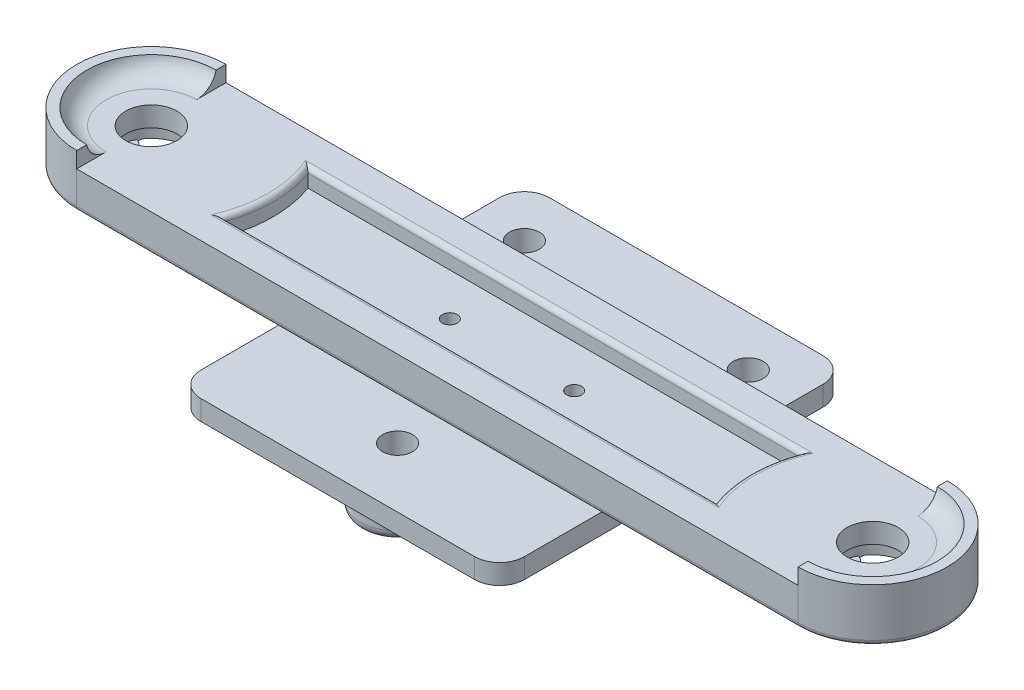
from build123d import *

# Parameters (mm, degrees)
CROQUIS1_R               = 15
CROQUIS1_R_2             = 5.15
SALIENTE_EXTRUIR1_DEPTH  = 7.5
CROQUIS2_R               = 5.15
CORTAR_EXTRUIR1_DEPTH    = 3.5
SALIENTE_EXTRUIR6_DEPTH  = 3.2
CROQUIS13_R              = 1.5
CORTAR_EXTRUIR2_DEPTH    = 3.6
REDONDEO1_R              = 4
REDONDEO2_R              = 1
REDONDEO3_R              = 1
SALIENTE_EXTRUIR7_START  = 2
SALIENTE_EXTRUIR7_DEPTH  = 2
REDONDEO5_R              = 1
SALIENTE_EXTRUIR8_DEPTH  = 4
CROQUIS13_2_R            = 1.5
CORTAR_EXTRUIR3_DEPTH    = 95.939454391
CROQUIS16_R              = 7.5
CROQUIS16_R_2            = 3
SALIENTE_EXTRUIR9_DEPTH  = 8
CROQUIS16_3_R            = 7.5
CROQUIS16_3_R_2          = 3
SALIENTE_EXTRUIR10_DEPTH = 8
CROQUIS16_4_R            = 3
CORTAR_EXTRUIR4_DEPTH    = 96.379976934
REDONDEO6_R              = 2
CROQUIS19_R              = 3
CORTAR_EXTRUIR5_DEPTH    = 96.379976934


with BuildPart() as part:
    # Croquis1 → Saliente-Extruir1 (new body)
    # profile 1 of 3: a face of its own
    with BuildSketch(Plane(origin=(0, 0, 0), x_dir=(1, 0, 0), z_dir=(0, 1, 0))):
        with Locations((-72.5, 0)):
            Circle(CROQUIS1_R)
        with Locations(Location((-72.5, 0, 0), (0, 0, 270))):
            Circle(CROQUIS1_R_2, mode=Mode.SUBTRACT)
    # profile 2 of 3: a face of its own
    with BuildSketch(Plane(origin=(0, 0, 0), x_dir=(1, 0, 0), z_dir=(0, 1, 0))):
        with BuildLine():
            Line((72.5, 15), (-72.5, 15))
            ThreePointArc((-72.5, 15), (-61.893398282, 10.606601718), (-57.5, 0))
            ThreePointArc((-57.5, 0), (-61.893398282, -10.606601718), (-72.5, -15))
            Line((-72.5, -15), (72.5, -15))
            ThreePointArc((72.5, -15), (57.5, 0), (72.5, 15))
        make_face()
    # profile 3 of 3: a face of its own
    with BuildSketch(Plane(origin=(0, 0, 0), x_dir=(1, 0, 0), z_dir=(0, 1, 0))):
        with Locations((72.5, 0)):
            Circle(CROQUIS1_R)
        with Locations(Location((72.5, 0, 0), (0, 0, 270))):
            Circle(CROQUIS1_R_2, mode=Mode.SUBTRACT)
    extrude(amount=SALIENTE_EXTRUIR1_DEPTH)

    # Croquis2 → Cortar-Extruir1 (cut)
    with BuildSketch(Plane.XZ):
        with BuildLine():
            ThreePointArc((-72.5, -5.15), (-77.65, 0), (-72.5, 5.15))
            Line((-72.5, 5.15), (-72.5, 7.5))
            ThreePointArc((-72.5, 7.5), (-80, 0), (-72.5, -7.5))
            Line((-72.5, -7.5), (-72.5, -5.15))
        make_face()
        with BuildLine():
            Line((-72.5, 7.5), (-72.5, 5.15))
            ThreePointArc((-72.5, 5.15), (-68.858400077, 3.641599923), (-67.35, 0))
            ThreePointArc((-67.35, 0), (-68.858400077, -3.641599923), (-72.5, -5.15))
            Line((-72.5, -5.15), (-72.5, -7.5))
            ThreePointArc((-72.5, -7.5), (-65, 0), (-72.5, 7.5))
        make_face()
        with BuildLine():
            Line((72.5, -7.5), (72.5, -5.15))
            ThreePointArc((72.5, -5.15), (67.35, 0), (72.5, 5.15))
            Line((72.5, 5.15), (72.5, 7.5))
            ThreePointArc((72.5, 7.5), (65, 0), (72.5, -7.5))
        make_face()
        with BuildLine():
            ThreePointArc((77.65, 0), (76.141599923, -3.641599923), (72.5, -5.15))
            Line((72.5, -5.15), (72.5, -7.5))
            ThreePointArc((72.5, -7.5), (80, 0), (72.5, 7.5))
            Line((72.5, 7.5), (72.5, 5.15))
            ThreePointArc((72.5, 5.15), (76.141599923, 3.641599923), (77.65, 0))
        make_face()
        with Locations(Location((72.5, 0, 0), (0, 0, 270))):
            Circle(CROQUIS2_R)
    extrude(amount=-CORTAR_EXTRUIR1_DEPTH, mode=Mode.SUBTRACT)

    # Croquis9 → Saliente-Extruir6 (add)
    with BuildSketch(Plane(origin=(0, 7.5, 0), x_dir=(1, 0, 0), z_dir=(0, 1, 0))):
        with BuildLine():
            Line((-72.5, 15), (-72.5, 13))
            ThreePointArc((-72.5, 13), (-85.5, 0), (-72.5, -13))
            Line((-72.5, -13), (-72.5, -15))
            ThreePointArc((-72.5, -15), (-87.5, 0), (-72.5, 15))
        make_face()
        with BuildLine():
            Line((72.5, 15), (72.5, 13))
            ThreePointArc((72.5, 13), (85.5, 0), (72.5, -13))
            Line((72.5, -13), (72.5, -15))
            ThreePointArc((72.5, -15), (87.5, 0), (72.5, 15))
        make_face()
    extrude(amount=SALIENTE_EXTRUIR6_DEPTH)

    # Croquis13 → Cortar-Extruir2 (cut)
    with BuildSketch(Plane(origin=(0, 7.5, 0), x_dir=(1, 0, 0), z_dir=(0, 1, 0))):
        with BuildLine():
            Line((49.521749414, -8.5), (-49.521749414, -8.5))
            ThreePointArc((-49.521749414, -8.5), (-48, 0), (-49.521749414, 8.5))
            Line((-49.521749414, 8.5), (49.521749414, 8.5))
            ThreePointArc((49.521749414, 8.5), (48, 0), (49.521749414, -8.5))
        make_face()
        with Locations(Location((-12.5, 0, 0), (0, 0, 270))):
            Circle(CROQUIS13_R, mode=Mode.SUBTRACT)
        with Locations(Location((12.5, 0, 0), (0, 0, 90))):
            Circle(CROQUIS13_R, mode=Mode.SUBTRACT)
    extrude(amount=-CORTAR_EXTRUIR2_DEPTH, mode=Mode.SUBTRACT)

    # Redondeo1
    # the kernel refuses this fillet: 4 mm, written as the material it adds along each edge
    with BuildSketch(Plane(origin=(72.5, 7.5, 0), x_dir=(0, 0, -1), z_dir=(-1, 0, 0))) as redondeo1_piece_1:
        with BuildLine():
            CenterArc((9.080816412, -4), REDONDEO1_R, 11.536959033, 78.463040967)
            Line((13, -3.2), (13.078383672, -3.184))
            ThreePointArc((13.078383672, -3.184), (13.08, -1.6), (13.08, 0))
            Line((13.08, 0), (13, 0.08))
            Line((13, 0.08), (9.080816412, 0.08))
            Line((9.080816412, 0.08), (9.080816412, 0))
        make_face()
    revolve(axis=Axis((72.5, 7.5, 0), (0, -1, 0)), revolution_arc=180)
    with BuildSketch(Plane(origin=(-72.5, 7.5, 0), x_dir=(0, 0, -1), z_dir=(1, 0, 0))) as redondeo1_piece_2:
        with BuildLine():
            CenterArc((9.080816412, 4), REDONDEO1_R, 270, 78.463040967)
            Line((13, 3.2), (13.078383672, 3.184))
            ThreePointArc((13.078383672, 3.184), (13.08, 1.6), (13.08, 0))
            Line((13.08, 0), (13, -0.08))
            Line((13, -0.08), (9.080816412, -0.08))
            Line((9.080816412, -0.08), (9.080816412, 0))
        make_face()
    revolve(axis=Axis((-72.5, 7.5, 0), (0, 1, 0)), revolution_arc=180)

    # Redondeo2
    redondeo2_edges = [part.edges().sort_by_distance(p)[0] for p in [
        (-87.5, 0, 0),
        (0, 0, -15),
        (87.5, 0, 0),
        (0, 0, 15),
    ]]
    fillet(redondeo2_edges, radius=REDONDEO2_R)

    # Redondeo3
    redondeo3_edges = [part.edges().sort_by_distance(p)[0] for p in [
        (48, 7.5, 0),
        (0, 7.5, -8.5),
        (-48, 7.5, 0),
        (0, 7.5, 8.5),
    ]]
    fillet(redondeo3_edges, radius=REDONDEO3_R)

    # Croquis14 → Saliente-Extruir7 (add)
    with BuildSketch(Plane.XZ.offset(SALIENTE_EXTRUIR7_START)):
        with BuildLine():
            Line((-78.934449598, 3.602473326), (-81.185988533, 4.205771366))
            ThreePointArc((-81.185988533, 4.205771366), (-82.2614458, 0), (-81.185988533, -4.205771366))
            Line((-81.185988533, -4.205771366), (-78.934449598, -3.602473326))
            ThreePointArc((-78.934449598, -3.602473326), (-77.733165492, -2.693023984), (-77.507447775, -1.203314912))
            ThreePointArc((-77.507447775, -1.203314912), (-77.65, 0), (-77.507447775, 1.203314912))
            ThreePointArc((-77.507447775, 1.203314912), (-77.733165492, 2.693023984), (-78.934449598, 3.602473326))
        make_face()
        with BuildLine():
            Line((-66.065550402, -3.602473326), (-63.814011467, -4.205771366))
            ThreePointArc((-63.814011467, -4.205771366), (-62.7385542, 0), (-63.814011467, 4.205771366))
            Line((-63.814011467, 4.205771366), (-66.065550402, 3.602473326))
            ThreePointArc((-66.065550402, 3.602473326), (-67.266834508, 2.693023984), (-67.492552225, 1.203314912))
            ThreePointArc((-67.492552225, 1.203314912), (-67.35, 0), (-67.492552225, -1.203314912))
            ThreePointArc((-67.492552225, -1.203314912), (-67.266834508, -2.693023984), (-66.065550402, -3.602473326))
        make_face()
    extrude(amount=-SALIENTE_EXTRUIR7_DEPTH)

    # Redondeo5
    # the kernel refuses this fillet: 1 mm, written as the material it takes off along each edge
    with BuildSketch(Plane(origin=(-81.185988533, -4.193298446, 4.205771366), x_dir=(-0.435508259696017, 0, -0.9001847342276733), z_dir=(0, 1, 0)), Plane(origin=(-63.814011467, -4.193298446, -4.205771366), x_dir=(0.435508259696011, 0, 0.9001847342276761), z_dir=(0, 1, 0))) as redondeo5_piece_1:
        with BuildLine():
            CenterArc((0.827252335, -0.998745859), REDONDEO5_R, 87.130169883, 82.052190477)
            Line((-0.15497718, -0.811062137), (0, 0))
            ThreePointArc((0, 0), (0.438659689, 0.010988087), (0.877319378, 0))
        make_face()
    extrude(amount=4.193298446, mode=Mode.SUBTRACT)
    with BuildSketch(Plane(origin=(-81.185988533, -4.193298446, -4.205771366), x_dir=(0.9659258262890669, 0, 0.2588190451025264), z_dir=(0, 1, 0)), Plane(origin=(-63.814011467, -4.193298446, 4.205771366), x_dir=(-0.9659258262890679, 0, -0.2588190451025224), z_dir=(0, 1, 0))) as redondeo5_piece_2:
        with BuildLine():
            CenterArc((0.825735864, -1), REDONDEO5_R, 90, 82.052190477)
            ThreePointArc((-0.164658567, -0.861728988), (-0.093122107, -0.428802209), (0, 0))
            Line((0, 0), (0.825735864, 0))
        make_face()
    extrude(amount=4.193298446, mode=Mode.SUBTRACT)
    with BuildSketch(Plane(origin=(-73.5, -2, 0), x_dir=(-0.7066256100563062, 0, 0.7075876251126452), z_dir=(0.7075876251126452, 0, 0.7066256100563062))) as redondeo5_piece_3:
        with BuildLine():
            CenterArc((8.7614458 - REDONDEO5_R, -REDONDEO5_R), REDONDEO5_R, 0, 90)
            Line((8.7614458 - REDONDEO5_R, 0), (8.7614458, 0))
            Line((8.7614458, 0), (8.7614458, -REDONDEO5_R))
        make_face()
    revolve(axis=Axis((-73.5, -2, 0), (0, -1, 0)), revolution_arc=90.077950613, mode=Mode.SUBTRACT)
    with BuildSketch(Plane(origin=(-71.5, -2, 0), x_dir=(0.706625610056301, 0, -0.70758762511265), z_dir=(-0.70758762511265, 0, -0.706625610056301))) as redondeo5_piece_4:
        with BuildLine():
            CenterArc((8.7614458 - REDONDEO5_R, -REDONDEO5_R), REDONDEO5_R, 0, 90)
            Line((8.7614458 - REDONDEO5_R, 0), (8.7614458, 0))
            Line((8.7614458, 0), (8.7614458, -REDONDEO5_R))
        make_face()
    revolve(axis=Axis((-71.5, -2, 0), (0, -1, 0)), revolution_arc=90.077950613, mode=Mode.SUBTRACT)
    # the kernel refuses this fillet: 1 mm, written as the material it adds along each edge
    with BuildSketch(Plane(origin=(-73.5, 0, 0), x_dir=(-0.920860386806379, 0, 0.38989248262925785), z_dir=(0.38989248262925785, 0, 0.920860386806379))) as redondeo5_2_piece_1:
        with BuildLine():
            CenterArc((8.7614458 + REDONDEO5_R, REDONDEO5_R), REDONDEO5_R, 180, 90)
            Line((8.7614458, REDONDEO5_R), (8.7614458, 0))
            Line((8.7614458, 0), (8.7614458 + REDONDEO5_R, 0))
        make_face()
    revolve(axis=Axis((-73.5, 0, 0), (0, -1, 0)), revolution_arc=45.895619046)
    with BuildSketch(Plane(origin=(-80.388388937, 0, -3.992055198), x_dir=(0.2588190451025228, 0, -0.9659258262890676), z_dir=(0.9659258262890678, 0, 0.25881904510252285))) as redondeo5_2_piece_2_section:
        with BuildLine():
            CenterArc((REDONDEO5_R, -REDONDEO5_R), REDONDEO5_R, 90, 90)
            Line((0, -REDONDEO5_R), (0, 0))
            Line((0, 0), (REDONDEO5_R, 0))
        make_face()
    redondeo5_2_piece_2 = extrude(amount=3.87558803, mode=Mode.PRIVATE)
    redondeo5_2_piece_2 = redondeo5_2_piece_2 - Plane(origin=(-72.5, 0, 0), x_dir=(0, 0, 1), z_dir=(0, -1, 0)) * Cylinder(7.5, 12, mode=Mode.PRIVATE)
    add(redondeo5_2_piece_2)
    with BuildSketch(Plane(origin=(-76.644858367, 0, 2.988979205), x_dir=(0.25881904510252285, 0, 0.9659258262890678), z_dir=(-0.9659258262890678, 0, 0.25881904510252285))) as redondeo5_2_piece_3_section:
        with BuildLine():
            CenterArc((REDONDEO5_R, -REDONDEO5_R), REDONDEO5_R, 90, 90)
            Line((0, -REDONDEO5_R), (0, 0))
            Line((0, 0), (REDONDEO5_R, 0))
        make_face()
    redondeo5_2_piece_3 = extrude(amount=3.87558803, mode=Mode.PRIVATE)
    redondeo5_2_piece_3 = redondeo5_2_piece_3 - Plane(origin=(-72.5, 0, 0), x_dir=(0, 0, 1), z_dir=(0, -1, 0)) * Cylinder(7.5, 12, mode=Mode.PRIVATE)
    add(redondeo5_2_piece_3)
    with BuildSketch(Plane(origin=(-68.355141633, 0, -2.988979205), x_dir=(-0.25881904510252285, 0, -0.9659258262890676), z_dir=(0.9659258262890678, 0, -0.25881904510252285))) as redondeo5_2_piece_4_section:
        with BuildLine():
            CenterArc((REDONDEO5_R, -REDONDEO5_R), REDONDEO5_R, 90, 90)
            Line((0, -REDONDEO5_R), (0, 0))
            Line((0, 0), (REDONDEO5_R, 0))
        make_face()
    redondeo5_2_piece_4 = extrude(amount=3.87558803, mode=Mode.PRIVATE)
    redondeo5_2_piece_4 = redondeo5_2_piece_4 - Plane(origin=(-72.5, 0, 0), x_dir=(0, 0, 1), z_dir=(0, -1, 0)) * Cylinder(7.5, 12, mode=Mode.PRIVATE)
    add(redondeo5_2_piece_4)
    with BuildSketch(Plane(origin=(-71.5, 0, 0), x_dir=(0.9208603868063772, 0, -0.38989248262926174), z_dir=(-0.38989248262926174, 0, -0.9208603868063772))) as redondeo5_2_piece_5:
        with BuildLine():
            CenterArc((8.7614458 + REDONDEO5_R, REDONDEO5_R), REDONDEO5_R, 180, 90)
            Line((8.7614458, REDONDEO5_R), (8.7614458, 0))
            Line((8.7614458, 0), (8.7614458 + REDONDEO5_R, 0))
        make_face()
    revolve(axis=Axis((-71.5, 0, 0), (0, -1, 0)), revolution_arc=45.895619046)
    with BuildSketch(Plane(origin=(-64.611611063, 0, 3.992055198), x_dir=(-0.2588190451025229, 0, 0.9659258262890679), z_dir=(-0.9659258262890678, 0, -0.25881904510252285))) as redondeo5_2_piece_6_section:
        with BuildLine():
            CenterArc((REDONDEO5_R, -REDONDEO5_R), REDONDEO5_R, 90, 90)
            Line((0, -REDONDEO5_R), (0, 0))
            Line((0, 0), (REDONDEO5_R, 0))
        make_face()
    redondeo5_2_piece_6 = extrude(amount=3.87558803, mode=Mode.PRIVATE)
    redondeo5_2_piece_6 = redondeo5_2_piece_6 - Plane(origin=(-72.5, 0, 0), x_dir=(0, 0, 1), z_dir=(0, -1, 0)) * Cylinder(7.5, 12, mode=Mode.PRIVATE)
    add(redondeo5_2_piece_6)
    with BuildSketch(Plane(origin=(-64.352792018, 0, 3.026129372), x_dir=(-0.2588190451025269, 0, 0.9659258262890666), z_dir=(-0.9659258262890666, 0, -0.2588190451025269))) as redondeo5_2_piece_7:
        with BuildLine():
            CenterArc((1 + REDONDEO5_R, -REDONDEO5_R), REDONDEO5_R, 90, 90)
            Line((1, -REDONDEO5_R), (1, 0))
            Line((1, 0), (1 + REDONDEO5_R, 0))
        make_face()
    revolve(axis=Axis((-64.352792018, 0, 3.026129372), (0, 1, 0)), revolution_arc=82.052190477)
    with BuildSketch(Plane(origin=(-64.352792018, 0, -3.026129372), x_dir=(0.920860386806377, 0, -0.38989248262926257), z_dir=(0.38989248262926257, 0, 0.920860386806377))) as redondeo5_2_piece_8:
        with BuildLine():
            CenterArc((1 + REDONDEO5_R, -REDONDEO5_R), REDONDEO5_R, 90, 90)
            Line((1, -REDONDEO5_R), (1, 0))
            Line((1, 0), (1 + REDONDEO5_R, 0))
        make_face()
    revolve(axis=Axis((-64.352792018, 0, -3.026129372), (0, 1, 0)), revolution_arc=82.052190477)
    with BuildSketch(Plane(origin=(-80.647207982, 0, 3.026129372), x_dir=(-0.9208603868063799, 0, 0.38989248262925547), z_dir=(-0.38989248262925547, 0, -0.9208603868063799))) as redondeo5_2_piece_9:
        with BuildLine():
            CenterArc((1 + REDONDEO5_R, -REDONDEO5_R), REDONDEO5_R, 90, 90)
            Line((1, -REDONDEO5_R), (1, 0))
            Line((1, 0), (1 + REDONDEO5_R, 0))
        make_face()
    revolve(axis=Axis((-80.647207982, 0, 3.026129372), (0, 1, 0)), revolution_arc=82.052190477)
    with BuildSketch(Plane(origin=(-80.647207982, 0, -3.026129372), x_dir=(0.2588190451025269, 0, -0.9659258262890666), z_dir=(0.9659258262890666, 0, 0.2588190451025269))) as redondeo5_2_piece_10:
        with BuildLine():
            CenterArc((1 + REDONDEO5_R, -REDONDEO5_R), REDONDEO5_R, 90, 90)
            Line((1, -REDONDEO5_R), (1, 0))
            Line((1, 0), (1 + REDONDEO5_R, 0))
        make_face()
    revolve(axis=Axis((-80.647207982, 0, -3.026129372), (0, 1, 0)), revolution_arc=82.052190477)

    # Simetría1: read off the stored shape, not the designer's step
    # Simetría1: part across plane


with BuildPart() as part_1:
    add(part.part)
    add(part.part.mirror(Plane(origin=(0, 0, 0), x_dir=(0, 0, 1), z_dir=(1, 0, 0))))

    # Croquis15 → Saliente-Extruir8 (add)
    with BuildSketch(Plane(origin=(0, 0, 0), x_dir=(1, 0, 0), z_dir=(0, 1, 0))):
        with BuildLine():
            Line((-27.5, 35), (27.5, 35))
            ThreePointArc((27.5, 35), (31.035533906, 33.535533906), (32.5, 30))
            Line((32.5, 30), (32.5, -30))
            ThreePointArc((32.5, -30), (31.035533906, -33.535533906), (27.5, -35))
            Line((27.5, -35), (-27.5, -35))
            ThreePointArc((-27.5, -35), (-31.035533906, -33.535533906), (-32.5, -30))
            Line((-32.5, -30), (-32.5, 30))
            ThreePointArc((-32.5, 30), (-31.035533906, 33.535533906), (-27.5, 35))
        make_face()
    extrude(amount=-SALIENTE_EXTRUIR8_DEPTH)

    # Croquis13<2> → Cortar-Extruir3 (cut, through all)
    with BuildSketch(Plane(origin=(0, 7.5, 0), x_dir=(1, 0, 0), z_dir=(0, 1, 0))):
        with Locations(Location((-12.5, 0, 0), (0, 0, 270))):
            Circle(CROQUIS13_2_R)
        with Locations(Location((12.5, 0, 0), (0, 0, 270))):
            Circle(CROQUIS13_2_R)
    extrude(amount=-CORTAR_EXTRUIR3_DEPTH, mode=Mode.SUBTRACT)

    # Croquis16 → Saliente-Extruir9 (add)
    with BuildSketch(Plane.XZ.offset(4)):
        with Locations(Location((0, 23, 0), (0, 0, 90))):
            Circle(CROQUIS16_R)
        with Locations(Location((0, 23, 0), (0, 0, 270))):
            Circle(CROQUIS16_R_2, mode=Mode.SUBTRACT)
    extrude(amount=SALIENTE_EXTRUIR9_DEPTH)

    # Croquis16<3> → Saliente-Extruir10 (add)
    with BuildSketch(Plane.XZ.offset(4)):
        with Locations(Location((-22.5, -25, 0), (0, 0, 90))):
            Circle(CROQUIS16_3_R)
        with Locations(Location((-22.5, -25, 0), (0, 0, 270))):
            Circle(CROQUIS16_3_R_2, mode=Mode.SUBTRACT)
    saliente_extruir10 = extrude(amount=SALIENTE_EXTRUIR10_DEPTH)

    # Croquis17 → Cortar-Revolución1 (revolve, cut)
    with BuildSketch(Plane.XY.offset(23)):
        with BuildLine():
            Line((5.125, -9.5), (-5.125, -9.5))
            ThreePointArc((-5.125, -9.5), (0, -14.625), (5.125, -9.5))
        make_face()
    revolve(axis=Axis((5.125, -9.5, 23), (-1, 0, 0)), mode=Mode.SUBTRACT)

    # Croquis18 → Cortar-Revolución2 (revolve, cut)
    with BuildSketch(Plane(origin=(0, 0, -25), x_dir=(-1, 0, 0), z_dir=(0, 0, -1))):
        with BuildLine():
            ThreePointArc((26.973882542, -12), (27.459550031, -10.791699844), (27.625, -9.5))
            Line((27.625, -9.5), (17.375, -9.5))
            ThreePointArc((17.375, -9.5), (17.540449969, -10.791699844), (18.026117458, -12))
            Line((18.026117458, -12), (26.973882542, -12))
        make_face()
        with BuildLine():
            ThreePointArc((18.026117458, -12), (22.5, -14.625), (26.973882542, -12))
            Line((26.973882542, -12), (18.026117458, -12))
        make_face()
    cortar_revoluci_n2 = revolve(axis=Axis((-27.625, -9.5, -25), (1, 0, 0)), mode=Mode.SUBTRACT)

    # Croquis16<4> → Cortar-Extruir4 (cut, through all)
    with BuildSketch(Plane.XZ.offset(4)):
        with Locations(Location((0, 23, 0), (0, 0, 90))):
            Circle(CROQUIS16_4_R)
        with Locations(Location((-22.5, -25, 0), (0, 0, 90))):
            Circle(CROQUIS16_4_R)
    extrude(amount=-CORTAR_EXTRUIR4_DEPTH, mode=Mode.SUBTRACT)

    # Simetría2: Saliente-Extruir10, Cortar-Revolución2 across plane
    add(saliente_extruir10.mirror(Plane(origin=(0, 0, 0), x_dir=(0, 0, 1), z_dir=(1, 0, 0))))
    add(cortar_revoluci_n2.mirror(Plane(origin=(0, 0, 0), x_dir=(0, 0, 1), z_dir=(1, 0, 0))), mode=Mode.SUBTRACT)

    # Redondeo6
    redondeo6_edges = [part_1.edges().sort_by_distance(p)[0] for p in [
        (0, -4, 15.5),
        (0, -12, 15.5),
        (-22.5, -4, -32.5),
        (-22.5, -12, -32.5),
        (22.5, -12, -32.5),
        (22.5, -4, -32.5),
    ]]
    fillet(redondeo6_edges, radius=REDONDEO6_R)

    # Croquis19 → Cortar-Extruir5 (cut, through all)
    with BuildSketch(Plane.XZ.offset(4)):
        with Locations(Location((22.5, -25, 0), (0, 0, 90))):
            Circle(CROQUIS19_R)
    extrude(amount=-CORTAR_EXTRUIR5_DEPTH, mode=Mode.SUBTRACT)


solid = part_1.part
